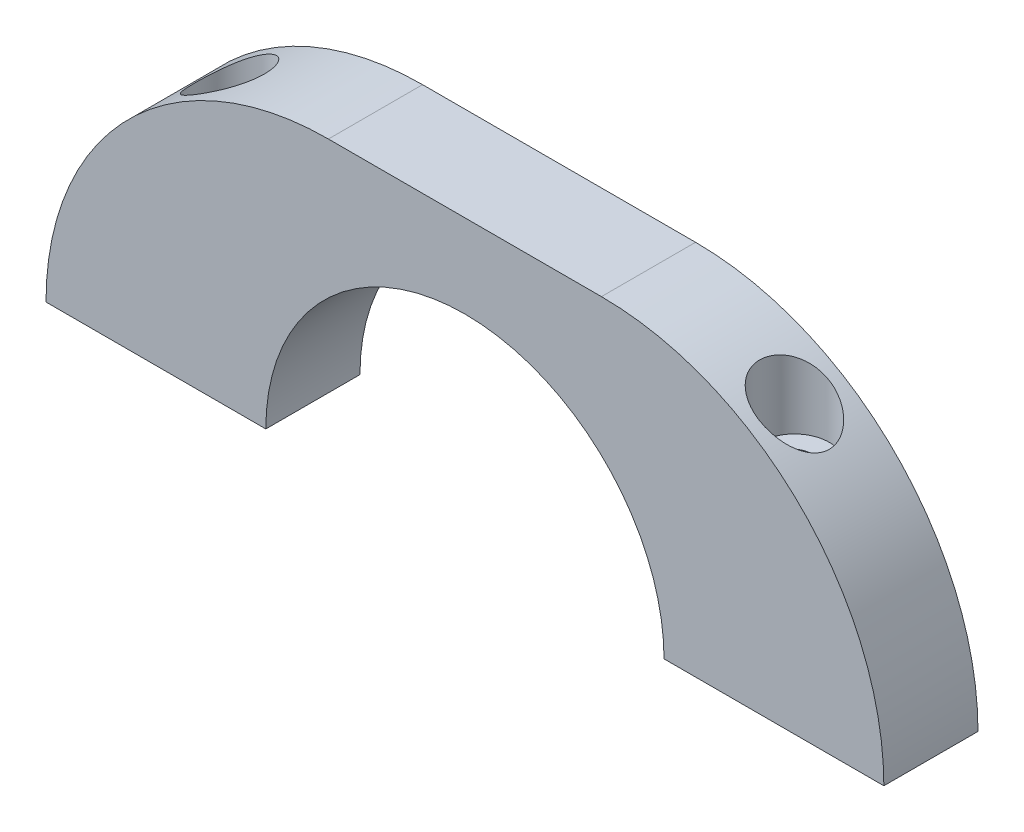
from build123d import *

# Parameters (mm, degrees)
SKETCH_1_W          = 89
SKETCH_1_H          = 10
EXTRUDE_1_DEPTH     = 30
SKETCH_2_R          = 21.15
CUT_EXTRUDE_1_DEPTH = 20
SKETCH_3_R          = 1.7
CUT_EXTRUDE_2_DEPTH = 60
SKETCH_4_R          = 3.7
CUT_EXTRUDE_3_DEPTH = 10
FILLET_START        = -5
FILLET_1_DEPTH      = 10


with BuildPart() as part:
    # 草图1 → 凸台-拉伸1 (new body)
    with BuildSketch(Plane(origin=(0, 0, 0), x_dir=(1, 0, 0), z_dir=(0, 1, 0))):
        Rectangle(SKETCH_1_W, SKETCH_1_H)
    extrude(amount=EXTRUDE_1_DEPTH)

    # 草图2 → 切除-拉伸1 (cut)
    with BuildSketch(Plane.XY.offset(5)):
        Circle(SKETCH_2_R)
    extrude(amount=-CUT_EXTRUDE_1_DEPTH, mode=Mode.SUBTRACT)

    # 草图3 → 切除-拉伸2 (cut)
    with BuildSketch(Plane.XZ):
        with Locations(Location((-30, 0, 0), (0, 0, 270))):
            Circle(SKETCH_3_R)
        with Locations(Location((30, 0, 0), (0, 0, 270))):
            Circle(SKETCH_3_R)
    extrude(amount=-CUT_EXTRUDE_2_DEPTH, mode=Mode.SUBTRACT)

    # 草图4 → 切除-拉伸3 (cut)
    with BuildSketch(Plane(origin=(0, 30, 0), x_dir=(1, 0, 0), z_dir=(0, 1, 0))):
        with Locations(Location((-30, 0, 0), (0, 0, 270))):
            Circle(SKETCH_4_R)
        with Locations(Location((30, 0, 0), (0, 0, 270))):
            Circle(SKETCH_4_R)
    extrude(amount=-CUT_EXTRUDE_3_DEPTH, mode=Mode.SUBTRACT)

    # 圆角1: read off the stored shape, not the designer's step
    # 圆角1 outline → 圆角1 (cut)
    with BuildSketch(Plane.XY.offset(FILLET_START)):
        with BuildLine():
            ThreePointArc((-44.5, 0), (-35.713203436, 21.213203436), (-14.5, 30))
            Line((-14.5, 30), (-44.5, 30))
            Line((-44.5, 30), (-44.5, 0))
        make_face()
        with BuildLine():
            ThreePointArc((14.5, 30), (35.713203436, 21.213203436), (44.5, 0))
            Line((44.5, 0), (44.5, 30))
            Line((44.5, 30), (14.5, 30))
        make_face()
    extrude(amount=FILLET_1_DEPTH, mode=Mode.SUBTRACT)


solid = part.part
